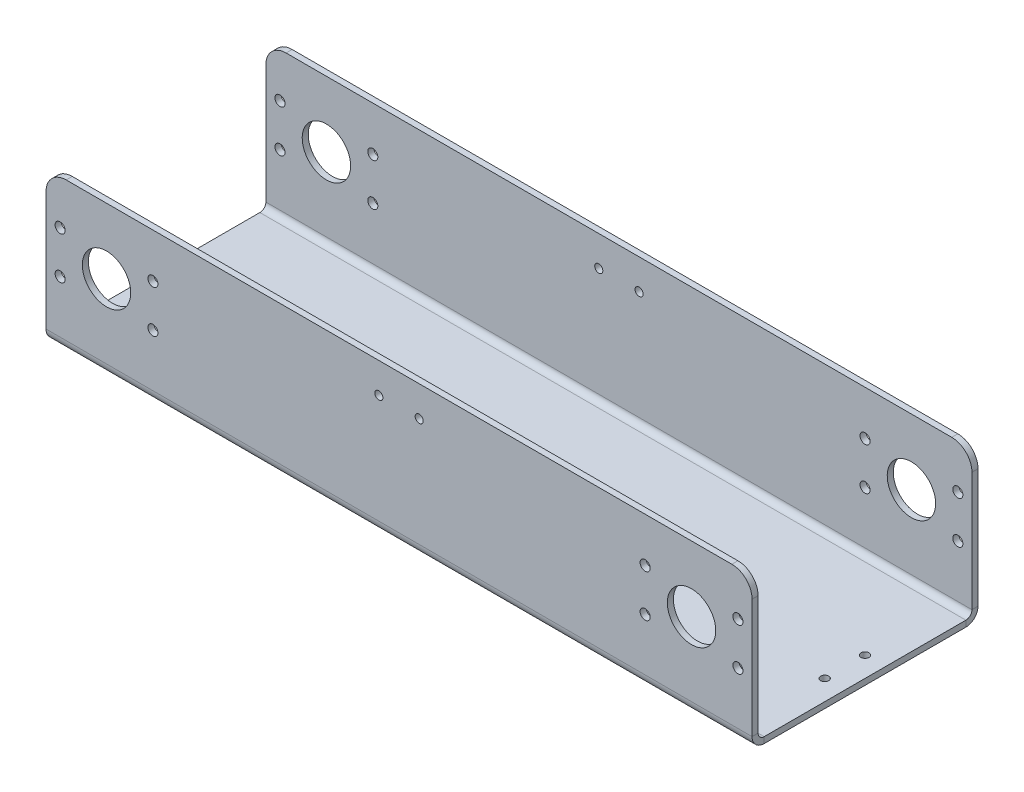
from build123d import *

# Parameters (mm, degrees)
SKETCH1_W                    = 350
SKETCH1_H                    = 100
BASE_FLANGE1_DEPTH           = 3
SM_EDGE_FLANGE_1_DEPTH       = 350
SM_EDGE_FLANGE_1_BEND_DEPTH  = 350
F_5_0_5_DIAMETER_HOLE1_D     = 5
SKETCH14_R                   = 12
CUT_EXTRUDE1_DEPTH           = 375.470292547
F_4_0_4_DIAMETER_HOLE1_D     = 4
F_4_0_4_DIAMETER_HOLE1_DEPTH = 3
F_4_0_4_DIAMETER_HOLE2_D     = 4
FILLET1_R                    = 10


# Sheet-metal steps are written as plain solids
with BuildPart() as part:
    # Sketch1 → Base-Flange1 (new body)
    with BuildSketch(Plane(origin=(0, 0, 0), x_dir=(1, 0, 0), z_dir=(0, 1, 0))):
        with Locations((-175, 0)):
            Rectangle(SKETCH1_W, SKETCH1_H)
    extrude(amount=-BASE_FLANGE1_DEPTH)

    # 邊線-凸緣1 section (across the edge) → 邊線-凸緣1 (add)
    with BuildSketch(Plane(origin=(-350, 0, 53), x_dir=(0, 0, -1), z_dir=(1, 0, 0))):
        with BuildLine():
            Line((-3, 3), (-3, 72))
            Line((-3, 72), (0, 72))
            Line((0, 72), (0, 3))
            ThreePointArc((0, 3), (0.878679656, 0.878679656), (3, 0))
            Line((3, 0), (3, -3))
            ThreePointArc((3, -3), (-1.242640687, -1.242640687), (-3, 3))
        make_face()
    extrude(amount=SM_EDGE_FLANGE_1_DEPTH)

    # 邊線-凸緣1 section 2 (across the edge) → 邊線-凸緣1 bend (add)
    with BuildSketch(Plane(origin=(0, 0, -53), x_dir=(0, 0, 1), z_dir=(-1, 0, 0))):
        with BuildLine():
            Line((-3, 3), (-3, 72))
            Line((-3, 72), (0, 72))
            Line((0, 72), (0, 3))
            ThreePointArc((0, 3), (0.878679656, 0.878679656), (3, 0))
            Line((3, 0), (3, -3))
            ThreePointArc((3, -3), (-1.242640687, -1.242640687), (-3, 3))
        make_face()
    extrude(amount=SM_EDGE_FLANGE_1_BEND_DEPTH)

    # Ø5.0 (5) Diameter Hole1 (through all)
    with Locations(Plane.XY.offset(56)):
        with Locations((-343, 50), (-343, 29), (-297, 50), (-297, 29)):
            f_5_0_5_diameter_hole1 = Hole(F_5_0_5_DIAMETER_HOLE1_D / 2)

    # Sketch14 → Cut-Extrude1 (cut, symmetric)
    with BuildSketch(Plane.XY.offset(56)):
        with Locations((-320, 39.5)):
            Circle(SKETCH14_R)
    cut_extrude1 = extrude(amount=CUT_EXTRUDE1_DEPTH, both=True, mode=Mode.SUBTRACT)

    # Mirror1: Ø5.0 (5) Diameter Hole1, Cut-Extrude1 across plane
    add(f_5_0_5_diameter_hole1.mirror(Plane(origin=(-175, 0, 0), x_dir=(0, 0, 1), z_dir=(1, 0, 0))), mode=Mode.SUBTRACT)
    add(cut_extrude1.mirror(Plane(origin=(-175, 0, 0), x_dir=(0, 0, 1), z_dir=(1, 0, 0))), mode=Mode.SUBTRACT)

    # Ø4.0 (4) Diameter Hole1
    with Locations(Plane.XY.offset(-53)):
        with Locations((-185, 57), (-165, 57)):
            f_4_0_4_diameter_hole1 = Hole(F_4_0_4_DIAMETER_HOLE1_D / 2, depth=F_4_0_4_DIAMETER_HOLE1_DEPTH)

    # Ø4.0 (4) Diameter Hole2 (through all)
    with Locations(Plane(origin=(0, 0, 0), x_dir=(1, 0, 0), z_dir=(0, 1, 0))):
        with Locations((-340, 10), (-340, -10)):
            f_4_0_4_diameter_hole2 = Hole(F_4_0_4_DIAMETER_HOLE2_D / 2)

    # Mirror2: Ø4.0 (4) Diameter Hole2 across plane
    add(f_4_0_4_diameter_hole2.mirror(Plane(origin=(-175, 0, 0), x_dir=(0, 0, 1), z_dir=(1, 0, 0))), mode=Mode.SUBTRACT)

    # Mirror3: Ø4.0 (4) Diameter Hole1 across plane
    add(f_4_0_4_diameter_hole1.mirror(Plane.XY), mode=Mode.SUBTRACT)

    # Fillet1
    fillet1_edges = [part.edges().sort_by_distance(p)[0] for p in [
        (-350, 72, 54.5),
        (0, 72, 54.5),
        (0, 72, -54.5),
        (-350, 72, -54.5),
    ]]
    fillet(fillet1_edges, radius=FILLET1_R)


solid = part.part
